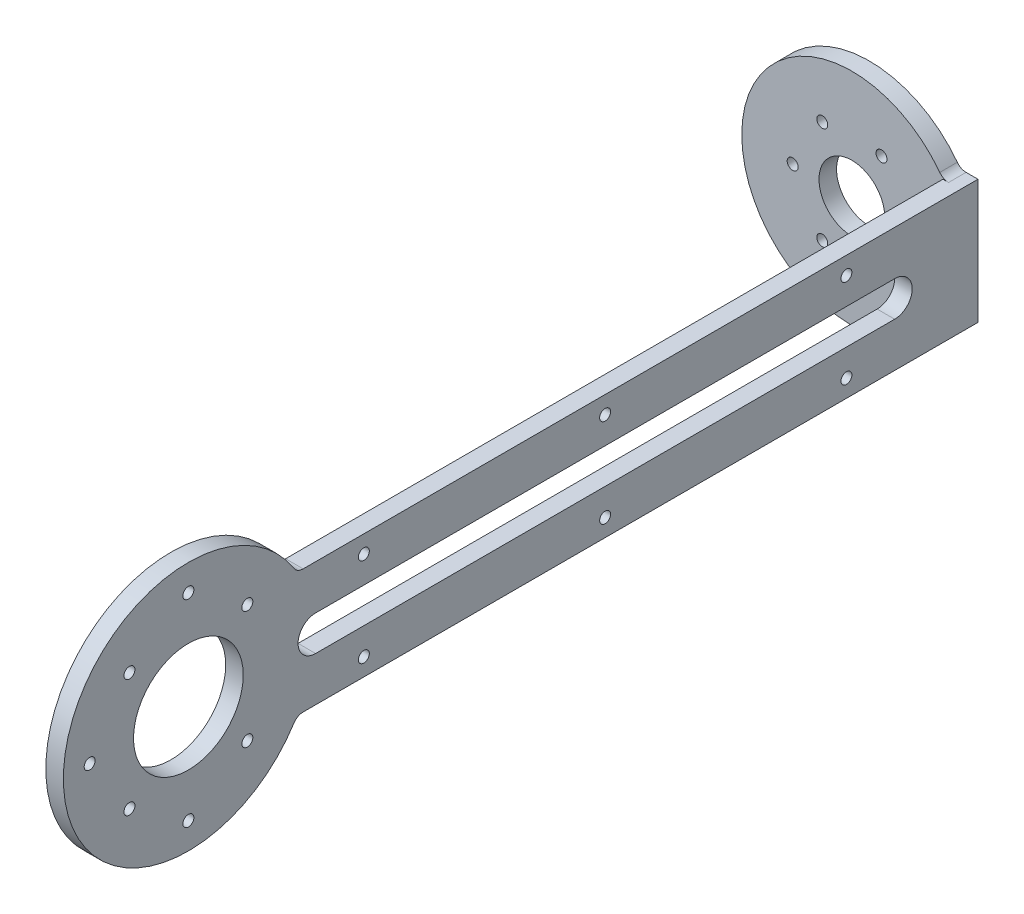
from build123d import *

# Parameters (mm, degrees)
SKETCH_1_R          = 28.5
EXTRUDE_1_DEPTH     = 4
SKETCH_2_R          = 1.25
CUT_EXTRUDE_2_DEPTH = 4
CUT_EXTRUDE_START   = -4
CUT_EXTRUDE_4_DEPTH = 4
SKETCH_5_R          = 7.5
CUT_EXTRUDE_5_DEPTH = 4
SKETCH_6_W          = 4
SKETCH_6_H          = 28.262165522
EXTRUDE_2_DEPTH     = 140
SKETCH_7_R          = 12.5
EXTRUDE_3_DEPTH     = 4
SKETCH_8_R          = 1.25
CUT_EXTRUDE_6_DEPTH = 4
SKETCH_9_R          = 1.25
SKETCH_9_W          = 140
SKETCH_9_H          = 8
CUT_EXTRUDE_7_DEPTH = 4
FILLET_1_R          = 4
FILLET_2_R          = 4
FILLET_3_R          = 2.5


with BuildPart() as part:
    # 草图1 → 凸台-拉伸1 (new body)
    with BuildSketch(Plane.XY):
        Circle(SKETCH_1_R)
    extrude(amount=EXTRUDE_1_DEPTH)

    # 草图2 → 切除-拉伸2 (cut)
    with BuildSketch(Plane.XY.offset(4)):
        with Locations((-13.5, 0)):
            Circle(SKETCH_2_R)
        with Locations((-6.75, 11.691342951)):
            Circle(SKETCH_2_R)
        with Locations((6.75, 11.691342951)):
            Circle(SKETCH_2_R)
        with Locations((6.75, -11.691342951)):
            Circle(SKETCH_2_R)
        with Locations((-6.75, -11.691342951)):
            Circle(SKETCH_2_R)
    extrude(amount=-CUT_EXTRUDE_2_DEPTH, mode=Mode.SUBTRACT)

    # 草图4 → 切除-拉伸4 (cut)
    with BuildSketch(Plane.XY.offset(4).offset(CUT_EXTRUDE_START)):
        with BuildLine():
            ThreePointArc((20.75, -14.131082761), (-25.104780421, 0), (20.75, 14.131082761))
            Line((20.75, 14.131082761), (24.75, 14.131082761))
            ThreePointArc((24.75, 14.131082761), (-28.5, 0), (24.75, -14.131082761))
            Line((24.75, -14.131082761), (20.75, -14.131082761))
        make_face()
        with BuildLine():
            Line((24.75, 14.131082761), (24.75, 0))
            Line((24.75, 0), (28.5, 0))
            ThreePointArc((28.5, 0), (27.546551508, 7.310095759), (24.75, 14.131082761))
        make_face()
        with BuildLine():
            Line((28.5, 0), (24.75, 0))
            Line((24.75, 0), (24.75, -14.131082761))
            ThreePointArc((24.75, -14.131082761), (27.546551508, -7.310095759), (28.5, 0))
        make_face()
    extrude(amount=CUT_EXTRUDE_4_DEPTH, mode=Mode.SUBTRACT)

    # 草图5 → 切除-拉伸5 (cut)
    with BuildSketch(Plane.XY.offset(4)):
        Circle(SKETCH_5_R)
    extrude(amount=-CUT_EXTRUDE_5_DEPTH, mode=Mode.SUBTRACT)

    # 草图6 → 凸台-拉伸2 (add)
    with BuildSketch(Plane.XY.offset(4)):
        with Locations((22.75, 0)):
            Rectangle(SKETCH_6_W, SKETCH_6_H)
    extrude(amount=EXTRUDE_2_DEPTH)

    # 草图7 → 凸台-拉伸3 (add)
    with BuildSketch(Plane(origin=(24.75, 0, 0), x_dir=(0, 0, -1), z_dir=(1, 0, 0))):
        with BuildLine():
            Line((-144, 14.131082761), (-155.25, 14.131082761))
            ThreePointArc((-155.25, 14.131082761), (-208.5, 0), (-155.25, -14.131082761))
            Line((-155.25, -14.131082761), (-144, -14.131082761))
            Line((-144, -14.131082761), (-144, 14.131082761))
        make_face()
        with Locations((-180, 0)):
            Circle(SKETCH_7_R, mode=Mode.SUBTRACT)
    extrude(amount=-EXTRUDE_3_DEPTH)

    # 草图8 → 切除-拉伸6 (cut)
    with BuildSketch(Plane(origin=(24.75, 0, 0), x_dir=(0, 0, -1), z_dir=(1, 0, 0))):
        with Locations((-166.564971157, 13.435028843)):
            Circle(SKETCH_8_R)
        with Locations((-166.564971157, -13.435028843)):
            Circle(SKETCH_8_R)
        with Locations((-193.435028843, -13.435028843)):
            Circle(SKETCH_8_R)
        with Locations((-193.435028843, 13.435028843)):
            Circle(SKETCH_8_R)
    extrude(amount=-CUT_EXTRUDE_6_DEPTH, mode=Mode.SUBTRACT)

    # 草图9 → 切除-拉伸7 (cut)
    with BuildSketch(Plane(origin=(24.75, 0, 0), x_dir=(0, 0, -1), z_dir=(1, 0, 0))):
        with Locations((-140, 10.131082761)):
            Circle(SKETCH_9_R)
        with Locations((-180, 22.5)):
            Circle(SKETCH_9_R)
        with Locations((-202.5, 0)):
            Circle(SKETCH_9_R)
        with Locations((-180, -22.5)):
            Circle(SKETCH_9_R)
        with Locations((-85, 10.131082761)):
            Circle(SKETCH_9_R)
        with Locations((-30, 10.131082761)):
            Circle(SKETCH_9_R)
        with Locations(Location((-30, -10.131082761, 0), (0, 0, 180))):
            Circle(SKETCH_9_R)
        with Locations(Location((-85, -10.131082761, 0), (0, 0, 180))):
            Circle(SKETCH_9_R)
        with Locations(Location((-140, -10.131082761, 0), (0, 0, 180))):
            Circle(SKETCH_9_R)
        with Locations((-85, 0)):
            Rectangle(SKETCH_9_W, SKETCH_9_H)
    extrude(amount=-CUT_EXTRUDE_7_DEPTH, mode=Mode.SUBTRACT)

    # 圆角1
    fillet_1_edges = [part.edges().sort_by_distance(p)[0] for p in [
        (22.75, -4, 155),
        (22.75, 4, 155),
    ]]
    fillet(fillet_1_edges, radius=FILLET_1_R - 0.0001)  # a hair under: the kernel refuses the full size

    # 圆角2
    fillet_2_edges = [part.edges().sort_by_distance(p)[0] for p in [
        (22.75, 4, 15),
        (22.75, -4, 15),
    ]]
    fillet(fillet_2_edges, radius=FILLET_2_R - 0.0001)  # a hair under: the kernel refuses the full size

    # 圆角3
    fillet_3_edges = [part.edges().sort_by_distance(p)[0] for p in [
        (22.75, -14.131082761, 155.25),
        (22.75, 14.131082761, 155.25),
        (20.75, -14.131082761, 2),
        (20.75, 14.131082761, 2),
    ]]
    fillet(fillet_3_edges, radius=FILLET_3_R)


solid = part.part
